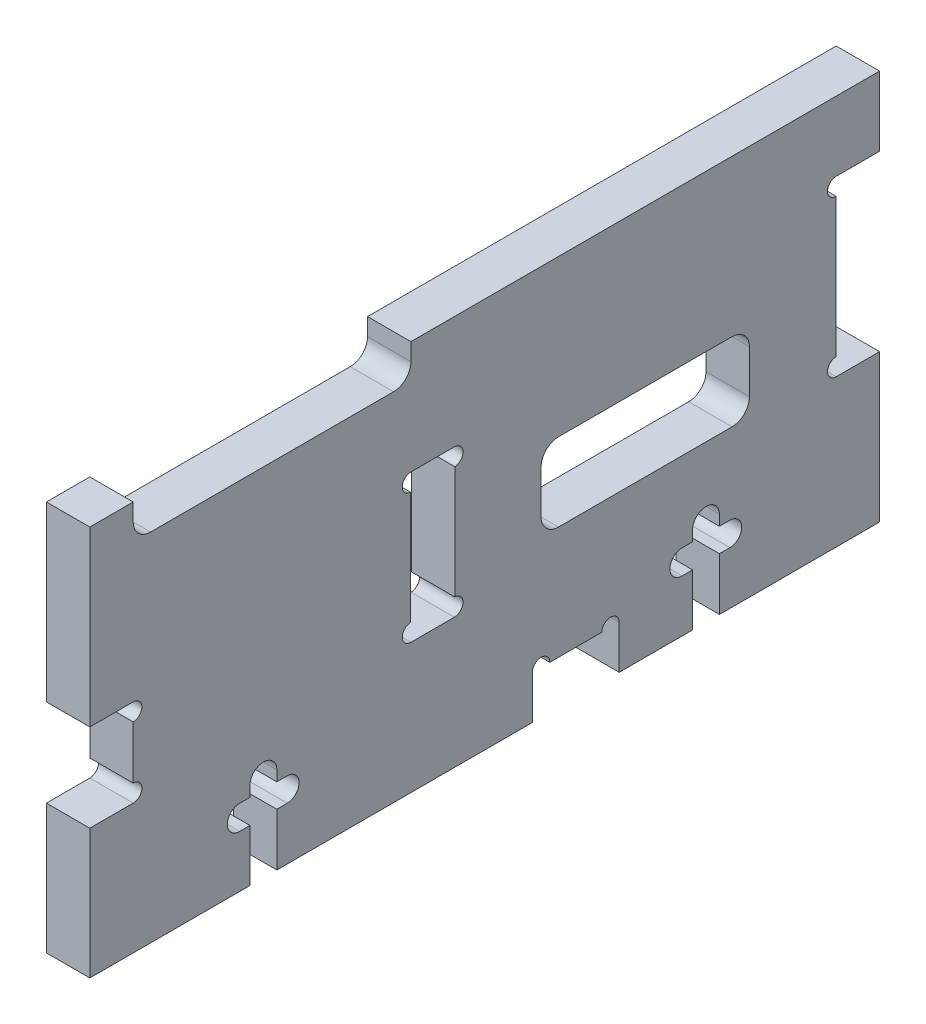
from build123d import *

# Parameters (mm, degrees)
SKETCH_1_W           = 91
SKETCH_1_H           = 45
EXTRUDE_1_DEPTH      = 5
SKETCH_7_W           = 24
SKETCH_7_H           = 9
CUT_EXTRUDE_3_DEPTH  = 10
FILLET_1_R           = 2
SKETCH_8_W           = 32
SKETCH_8_H           = 4
CUT_EXTRUDE_4_DEPTH  = 10
FILLET_2_R           = 2
SKETCH_9_W           = 5
SKETCH_9_H           = 17
CUT_EXTRUDE_5_DEPTH  = 5
SKETCH_10_R          = 1
CUT_EXTRUDE_6_DEPTH  = 10
CUT_EXTRUDE_8_DEPTH  = 10
SKETCH_15_W          = 10
SKETCH_15_H          = 5
CUT_EXTRUDE_10_DEPTH = 10
SKETCH_19_W          = 5
SKETCH_19_H          = 10.1
SKETCH_19_H_2        = 20
CUT_EXTRUDE_14_DEPTH = 5
SKETCH_16_R          = 1
CUT_EXTRUDE_11_DEPTH = 10
SKETCH_20_W          = 5.1
SKETCH_20_H          = 15.197667804
CUT_EXTRUDE_15_DEPTH = 10


with BuildPart() as part:
    # 스케치1 → 보스-돌출1 (new body)
    with BuildSketch(Plane(origin=(0, 0, 0), x_dir=(0, 0, -1), z_dir=(1, 0, 0))):
        with Locations((45.5, 22.5)):
            Rectangle(SKETCH_1_W, SKETCH_1_H)
    extrude(amount=EXTRUDE_1_DEPTH)

    # 스케치7 → 컷-돌출3 (cut)
    with BuildSketch(Plane(origin=(5, 0, 0), x_dir=(0, 0, -1), z_dir=(1, 0, 0))):
        with Locations((64, 22.5)):
            Rectangle(SKETCH_7_W, SKETCH_7_H)
    extrude(amount=-CUT_EXTRUDE_3_DEPTH, mode=Mode.SUBTRACT)

    # 필렛1
    fillet_1_edges = [part.edges().sort_by_distance(p)[0] for p in [
        (2.5, 18, -52),
        (2.5, 18, -76),
        (2.5, 27, -76),
        (2.5, 27, -52),
    ]]
    fillet(fillet_1_edges, radius=FILLET_1_R)

    # 스케치8 → 컷-돌출4 (cut)
    with BuildSketch(Plane(origin=(5, 0, 0), x_dir=(0, 0, -1), z_dir=(1, 0, 0))):
        with Locations((21, 43)):
            Rectangle(SKETCH_8_W, SKETCH_8_H)
    extrude(amount=-CUT_EXTRUDE_4_DEPTH, mode=Mode.SUBTRACT)

    # 필렛2
    fillet_2_edges = [part.edges().sort_by_distance(p)[0] for p in [
        (2.5, 41, -37),
        (2.5, 41, -5),
    ]]
    fillet(fillet_2_edges, radius=FILLET_2_R)

    # 스케치9 → 컷-돌출5 (cut)
    with BuildSketch(Plane.ZY):
        with Locations((-39.5, 23.5)):
            Rectangle(SKETCH_9_W, SKETCH_9_H)
    extrude(amount=-CUT_EXTRUDE_5_DEPTH, mode=Mode.SUBTRACT)

    # 스케치10 → 컷-돌출6 (cut)
    with BuildSketch(Plane(origin=(5, 0, 0), x_dir=(0, 0, -1), z_dir=(1, 0, 0))):
        with Locations((42, 31)):
            Circle(SKETCH_10_R)
        with Locations((42, 16)):
            Circle(SKETCH_10_R)
        with Locations((37, 16)):
            Circle(SKETCH_10_R)
        with Locations((37, 31)):
            Circle(SKETCH_10_R)
    extrude(amount=-CUT_EXTRUDE_6_DEPTH, mode=Mode.SUBTRACT)

    # 스케치13 → 컷-돌출8 (cut)
    with BuildSketch(Plane(origin=(5, 0, 0), x_dir=(0, 0, -1), z_dir=(1, 0, 0))):
        with BuildLine():
            Line((18.45, 0), (18.45, 6))
            Line((18.45, 6), (17.250192706, 6))
            ThreePointArc((17.250192706, 6), (15.841386702, 7.391138254), (17.232524956, 8.799944258))
            Line((17.232524956, 8.799944258), (18.45, 8.799944258))
            Line((18.45, 8.799944258), (18.45, 10))
            ThreePointArc((18.45, 10), (20, 11.55), (21.55, 10))
            Line((21.55, 10), (21.55, 8.799872773))
            Line((21.55, 8.799872773), (22.749807294, 8.799872773))
            ThreePointArc((22.749807294, 8.799872773), (24.117188413, 7.432491654), (22.749807294, 6.065110535))
            Line((22.749807294, 6.065110535), (21.55, 6.065110535))
            Line((21.55, 6.065110535), (21.55, 0))
            Line((21.55, 0), (18.45, 0))
        make_face()
        with BuildLine():
            Line((72.55, 0), (72.55, 6.065110535))
            Line((72.55, 6.065110535), (73.749807294, 6.065110535))
            ThreePointArc((73.749807294, 6.065110535), (75.117188413, 7.432491654), (73.749807294, 8.799872773))
            Line((73.749807294, 8.799872773), (72.55, 8.799872773))
            Line((72.55, 8.799872773), (72.55, 10))
            ThreePointArc((72.55, 10), (71, 11.55), (69.45, 10))
            Line((69.45, 10), (69.45, 8.799944258))
            Line((69.45, 8.799944258), (68.232524956, 8.799944258))
            ThreePointArc((68.232524956, 8.799944258), (66.841386702, 7.391138254), (68.250192706, 6))
            Line((68.250192706, 6), (69.45, 6))
            Line((69.45, 6), (69.45, 0))
            Line((69.45, 0), (72.55, 0))
        make_face()
    extrude(amount=-CUT_EXTRUDE_8_DEPTH, mode=Mode.SUBTRACT)

    # 스케치15 → 컷-돌출10 (cut)
    with BuildSketch(Plane(origin=(5, 0, 0), x_dir=(0, 0, -1), z_dir=(1, 0, 0))):
        with Locations((56, 2.5)):
            Rectangle(SKETCH_15_W, SKETCH_15_H)
    extrude(amount=-CUT_EXTRUDE_10_DEPTH, mode=Mode.SUBTRACT)

    # 스케치19 → 컷-돌출14 (cut)
    with BuildSketch(Plane.ZY):
        with Locations((-2.5, 20)):
            Rectangle(SKETCH_19_W, SKETCH_19_H)
        with Locations((-88.5, 27)):
            Rectangle(SKETCH_19_W, SKETCH_19_H_2)
    extrude(amount=-CUT_EXTRUDE_14_DEPTH, mode=Mode.SUBTRACT)

    # 스케치16 → 컷-돌출11 (cut)
    with BuildSketch(Plane.ZY):
        with Locations((-60, 5)):
            Circle(SKETCH_16_R)
        with Locations((-52, 5)):
            Circle(SKETCH_16_R)
        with Locations((-86, 36)):
            Circle(SKETCH_16_R)
        with Locations((-86, 18)):
            Circle(SKETCH_16_R)
        with Locations((-5, 24.05)):
            Circle(SKETCH_16_R)
        with Locations((-5, 15.95)):
            Circle(SKETCH_16_R)
    extrude(amount=-CUT_EXTRUDE_11_DEPTH, mode=Mode.SUBTRACT)

    # 스케치20 → 컷-돌출15 (cut)
    with BuildSketch(Plane(origin=(5, 0, 0), x_dir=(0, 0, -1), z_dir=(1, 0, 0))):
        with Locations((39.5, 23.598833902)):
            Rectangle(SKETCH_20_W, SKETCH_20_H)
    extrude(amount=-CUT_EXTRUDE_15_DEPTH, mode=Mode.SUBTRACT)


solid = part.part
